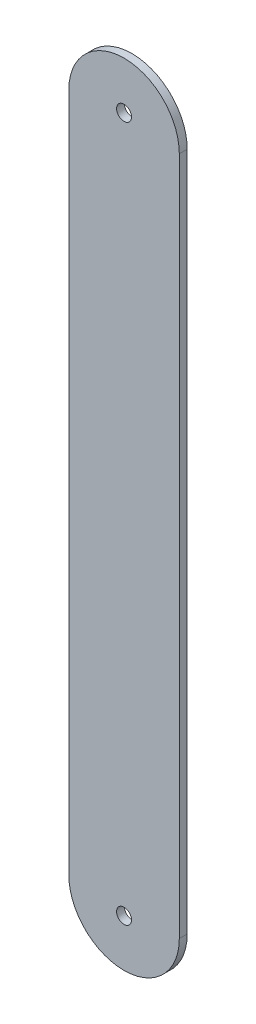
from build123d import *

# Parameters (mm, degrees)
SKETCH1_R           = 1.5
BOSS_EXTRUDE1_DEPTH = 1.5875


with BuildPart() as part:
    # Sketch1 → Boss-Extrude1 (new body)
    with BuildSketch(Plane.XY):
        with BuildLine():
            Line((11.1125, -68.3375), (11.1125, 68.3375))
            ThreePointArc((11.1125, 68.3375), (0, 79.45), (-11.1125, 68.3375))
            Line((-11.1125, 68.3375), (-11.1125, -68.3375))
            ThreePointArc((-11.1125, -68.3375), (0, -79.45), (11.1125, -68.3375))
        make_face()
        with Locations((0, 69.925)):
            Circle(SKETCH1_R, mode=Mode.SUBTRACT)
        with Locations((0, -69.925)):
            Circle(SKETCH1_R, mode=Mode.SUBTRACT)
    extrude(amount=BOSS_EXTRUDE1_DEPTH)


solid = part.part
